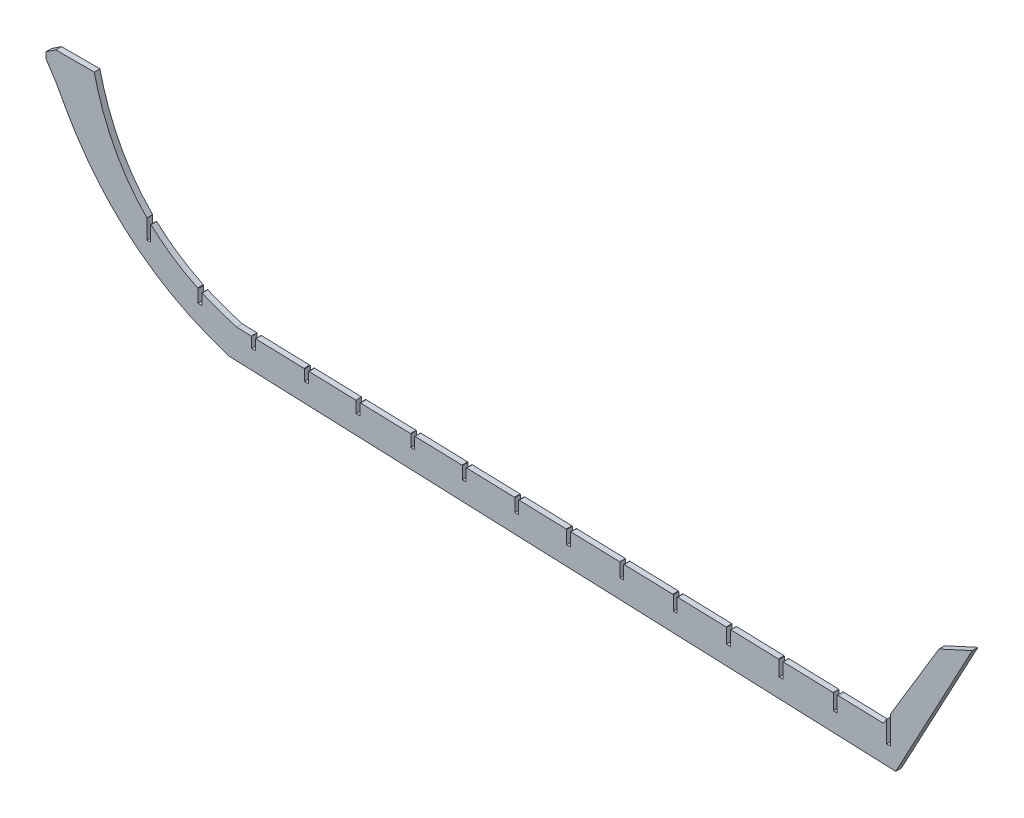
from build123d import *

# Parameters (mm, degrees)
BOSS_EXTRU_2_DEPTH      = 9
ENL_V_MAT_EXTRU_2_DEPTH = 9


with BuildPart() as part:
    # Esquisse2 → Boss.-Extru.2 (new body)
    with BuildSketch(Plane.XY):
        with BuildLine():
            Line((0, 0), (-1054.629910096, 41.504522095))
            add(Edge.make_bspline(
                [(-1054.629910096, 41.504522095), (-1224.898895692, 94.973668649), (-1312.524127552, 251.32222999)],
                knots=[0, 0, 0, 1, 1, 1], degree=2))
            Line((-1312.524127552, 251.32222999), (-1328.531696794, 280.319102935))
            Line((-1328.531696794, 280.319102935), (-1344.106951464, 303.85903019))
            Line((-1344.106951464, 303.85903019), (-1344.106951464, 313.726103663))
            Line((-1344.106951464, 313.726103663), (-1328.531696794, 324.031511808))
            Line((-1328.531696794, 324.031511808), (-1267.786373333, 324.031511808))
            add(Edge.make_bspline(
                [(-1267.786373333, 324.031511808), (-1224.243578326, 137.104736819), (-1042.241095265, 87.273554015)],
                knots=[0, 0, 0, 1, 1, 1], degree=2))
            Line((-1042.241095265, 87.273554015), (-19.342578419, 56.128666857))
            Line((-19.342578419, 56.128666857), (68.330488592, 201.78734955))
            Line((68.330488592, 201.78734955), (121.088242371, 225.986251341))
            Line((121.088242371, 225.986251341), (0, 0))
        make_face()
    extrude(amount=BOSS_EXTRU_2_DEPTH)

    # Esquisse4 → Enlèv. mat.-Extru.2 (cut)
    with BuildSketch(Plane.XY.offset(9)):
        Polygon((-1184.529602798, 165.625257232), (-1184.529602798, 135.448257781), (-1178.529602798, 135.448257781), (-1178.529602798, 159.848193824), (-1148.778615176, 162.133206692), (-1103.644457427, 109.431746416), (-1103.644457427, 89.382882562), (-1097.644457427, 89.382882562), (-1097.644457427, 106.656259625), (-1065.473536438, 118.031821421), (-1019.010707999, 86.291101209), (-1019.010707999, 69.825141164), (-1013.010707999, 69.825141164), (-1013.010707999, 86.108415126), (-968.986122001, 94.715454809), (-935.048554391, 83.734648387), (-935.048554391, 66.613746424), (-929.048554391, 66.613746424), (-929.048554391, 83.551962304), (-895.961109624, 92.314776132), (-853.677357938, 81.257084201), (-853.677357938, 63.31851584), (-847.677357938, 63.31851584), (-847.677357938, 81.074398118), (-802.198540596, 93.509303435), (-767.007980127, 78.618202682), (-767.007980127, 59.907678473), (-761.007980127, 59.907678473), (-761.007980127, 78.435516599), (-715.422898508, 88.814577228), (-685.459139962, 76.135229657), (-685.459139962, 56.698357737), (-679.459139962, 56.698357737), (-679.459139962, 75.952543574), (-642.529169259, 90.533708307), (-602.536147946, 73.610416895), (-602.536147946, 53.434957827), (-596.536147946, 53.434957827), (-596.536147946, 73.427730812), (-554.228753776, 85.390518635), (-520.486290487, 71.112189055), (-520.486290487, 50.205919764), (-514.486290487, 50.205919764), (-514.486290487, 70.929502973), (-485.818778234, 81.469195532), (-436.427460908, 68.552792675), (-436.427460908, 46.897819438), (-430.427460908, 46.897819438), (-430.427460908, 68.370106592), (-395.80060759, 80.200914059), (-351.840812464, 65.977325434), (-351.840812464, 43.56894702), (-345.840812464, 43.56894702), (-345.840812464, 65.794639351), (-303.137940146, 78.435516599), (-267.638115004, 63.41354861), (-267.638115004, 40.255184833), (-261.638115004, 40.255184833), (-261.638115004, 63.230862527), (-216.692202472, 71.261315551), (-184.626054736, 60.886023927), (-184.626054736, 36.988279678), (-178.626054736, 36.988279678), (-178.626054736, 60.703337844), (-152.318805778, 72.265594394), (-98.813045081, 58.273216832), (-98.813045081, 33.611144324), (-92.813045081, 33.611144324), (-92.813045081, 58.090530749), (-14.555231491, 64.274536633), (-14.555231491, 30.295213064), (-8.555231491, 30.295213064), (-8.555231491, 74.242844187), (-1172.693052787, 202.207608368), align=None)
    extrude(amount=-ENL_V_MAT_EXTRU_2_DEPTH, mode=Mode.SUBTRACT)


solid = part.part
